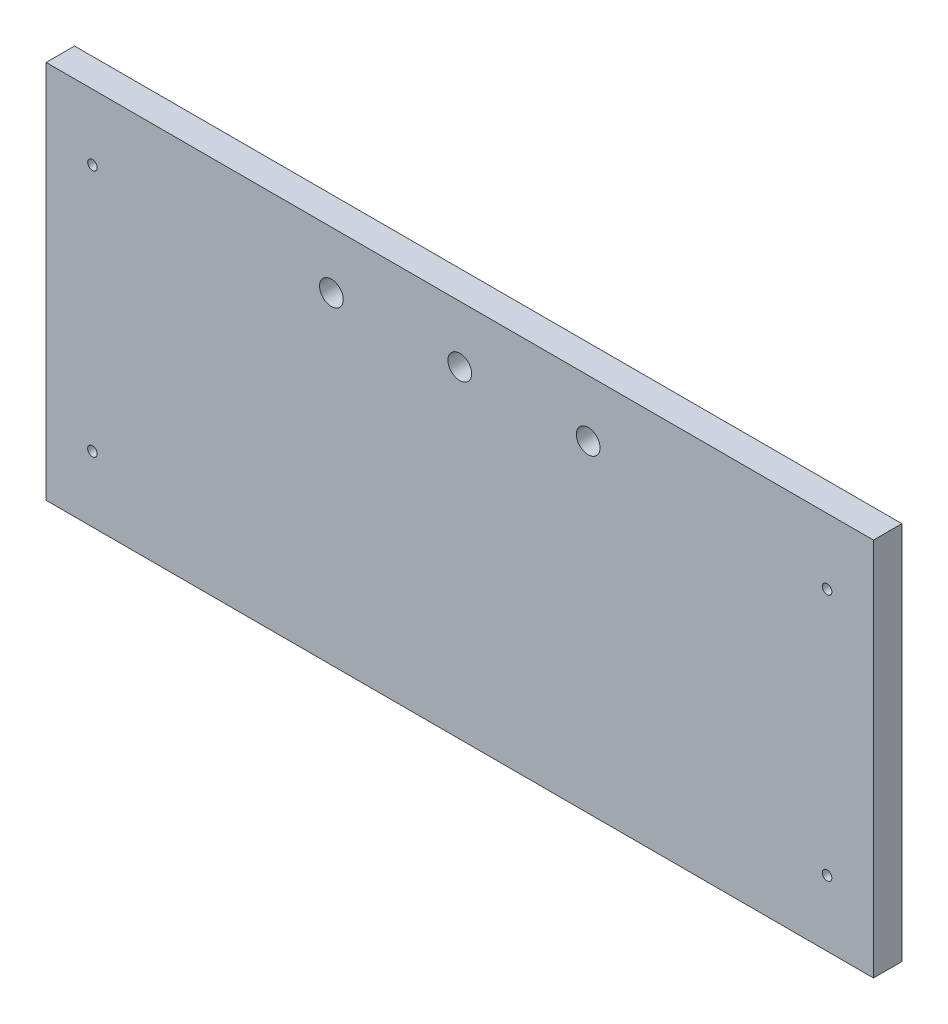
from build123d import *

# Parameters (mm, degrees)
SKETCH1_W           = 277.05
SKETCH1_H           = 127
SKETCH1_R           = 3.96875
SKETCH1_R_2         = 1.6
BOSS_EXTRUDE1_DEPTH = 9.525


with BuildPart() as part:
    # Sketch1 → Boss-Extrude1 (new body)
    with BuildSketch(Plane.XY):
        with Locations((138.525, 63.5)):
            Rectangle(SKETCH1_W, SKETCH1_H)
        with Locations((95.525, 107.95)):
            Circle(SKETCH1_R, mode=Mode.SUBTRACT)
        with Locations((138.525, 107.95)):
            Circle(SKETCH1_R, mode=Mode.SUBTRACT)
        with Locations((181.525, 107.95)):
            Circle(SKETCH1_R, mode=Mode.SUBTRACT)
        with Locations((15.525, 105)):
            Circle(SKETCH1_R_2, mode=Mode.SUBTRACT)
        with Locations((15.525, 22)):
            Circle(SKETCH1_R_2, mode=Mode.SUBTRACT)
        with Locations((261.525, 105)):
            Circle(SKETCH1_R_2, mode=Mode.SUBTRACT)
        with Locations((261.525, 22)):
            Circle(SKETCH1_R_2, mode=Mode.SUBTRACT)
    extrude(amount=BOSS_EXTRUDE1_DEPTH)


solid = part.part
